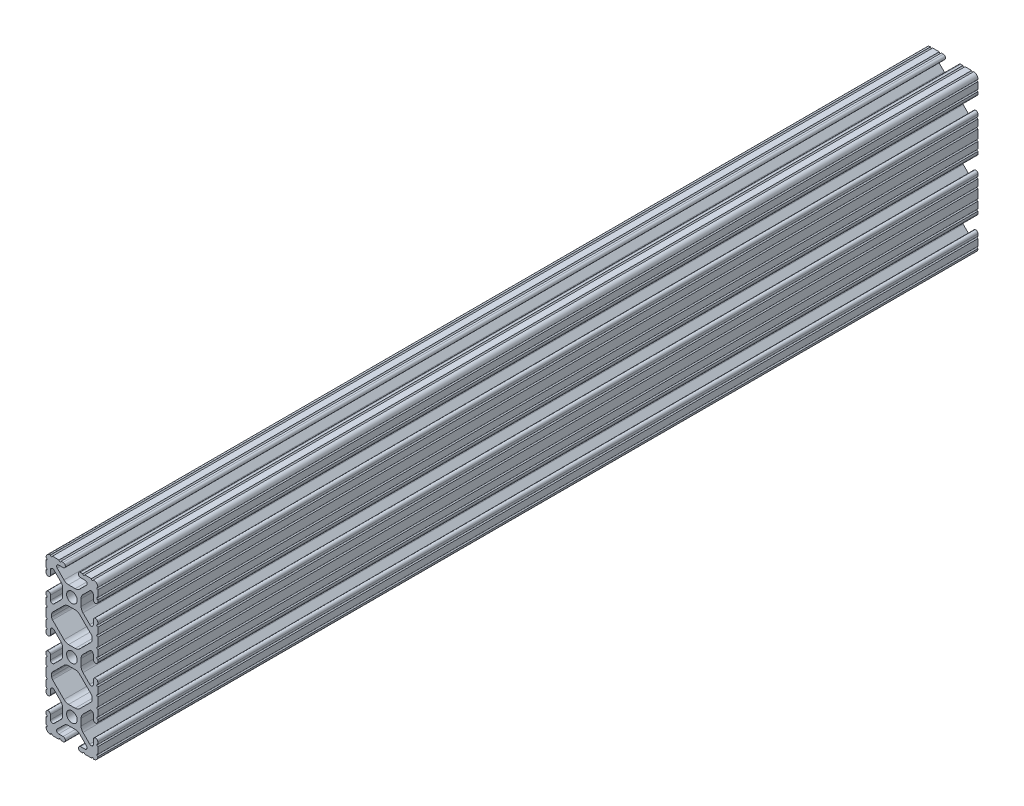
from build123d import *

# Parameters (mm, degrees)
SKETCH1_R           = 2.6035
BOSS_EXTRUDE1_DEPTH = 431.8


with BuildPart() as part:
    # Sketch1 → Boss-Extrude1 (new body)
    with BuildSketch(Plane.XY):
        with BuildLine():
            Line((-6.3246, 38.1), (-9.5504, 38.1))
            ThreePointArc((-9.5504, 38.1), (-10.0584, 37.592), (-10.5664, 38.1))
            ThreePointArc((-10.5664, 38.1), (-12.082677406, 37.482677406), (-12.7, 35.9664))
            ThreePointArc((-12.7, 35.9664), (-12.192, 35.4584), (-12.7, 34.9504))
            Line((-12.7, 34.9504), (-12.7, 31.7246))
            ThreePointArc((-12.7, 31.7246), (-12.192, 31.2166), (-12.7, 30.7086))
            Line((-12.7, 30.7086), (-12.7, 29.702307889))
            ThreePointArc((-12.7, 29.702307889), (-11.5951, 28.597407889), (-10.4902, 29.702307889))
            Line((-10.4902, 29.702307889), (-10.4902, 31.874794456))
            ThreePointArc((-10.4902, 31.874794456), (-9.863006367, 32.813456061), (-8.75577951, 32.593214945))
            Line((-8.75577951, 32.593214945), (-5.43843597, 29.275871405))
            ThreePointArc((-5.43843597, 29.275871405), (-4.750182484, 28.245827272), (-4.5085, 27.030807374))
            Line((-4.5085, 27.030807374), (-4.5085, 23.769192626))
            ThreePointArc((-4.5085, 23.769192626), (-4.750182484, 22.554172728), (-5.43843597, 21.524128595))
            Line((-5.43843597, 21.524128595), (-8.75577951, 18.206785055))
            ThreePointArc((-8.75577951, 18.206785055), (-9.863006367, 17.986543939), (-10.4902, 18.925205544))
            Line((-10.4902, 18.925205544), (-10.4902, 21.097692111))
            ThreePointArc((-10.4902, 21.097692111), (-11.5951, 22.202592111), (-12.7, 21.097692111))
            Line((-12.7, 21.097692111), (-12.7, 20.0914))
            ThreePointArc((-12.7, 20.0914), (-12.192, 19.5834), (-12.7, 19.0754))
            Line((-12.7, 19.0754), (-12.7, 15.8496))
            ThreePointArc((-12.7, 15.8496), (-12.192, 15.3416), (-12.7, 14.8336))
            Line((-12.7, 14.8336), (-12.7, 10.5664))
            ThreePointArc((-12.7, 10.5664), (-12.192, 10.0584), (-12.7, 9.5504))
            Line((-12.7, 9.5504), (-12.7, 6.3246))
            ThreePointArc((-12.7, 6.3246), (-12.192, 5.8166), (-12.7, 5.3086))
            Line((-12.7, 5.3086), (-12.7, 4.302307889))
            ThreePointArc((-12.7, 4.302307889), (-11.5951, 3.197407889), (-10.4902, 4.302307889))
            Line((-10.4902, 4.302307889), (-10.4902, 6.474794456))
            ThreePointArc((-10.4902, 6.474794456), (-9.863006367, 7.413456061), (-8.75577951, 7.193214945))
            Line((-8.75577951, 7.193214945), (-5.43843597, 3.875871405))
            ThreePointArc((-5.43843597, 3.875871405), (-4.750182484, 2.845827272), (-4.5085, 1.630807374))
            Line((-4.5085, 1.630807374), (-4.5085, -1.630807374))
            ThreePointArc((-4.5085, -1.630807374), (-4.750182484, -2.845827272), (-5.43843597, -3.875871405))
            Line((-5.43843597, -3.875871405), (-8.75577951, -7.193214945))
            ThreePointArc((-8.75577951, -7.193214945), (-9.863006367, -7.413456061), (-10.4902, -6.474794456))
            Line((-10.4902, -6.474794456), (-10.4902, -4.302307889))
            ThreePointArc((-10.4902, -4.302307889), (-11.5951, -3.197407889), (-12.7, -4.302307889))
            Line((-12.7, -4.302307889), (-12.7, -5.3086))
            ThreePointArc((-12.7, -5.3086), (-12.192, -5.8166), (-12.7, -6.3246))
            Line((-12.7, -6.3246), (-12.7, -9.5504))
            ThreePointArc((-12.7, -9.5504), (-12.192, -10.0584), (-12.7, -10.5664))
            Line((-12.7, -10.5664), (-12.7, -14.8336))
            ThreePointArc((-12.7, -14.8336), (-12.192, -15.3416), (-12.7, -15.8496))
            Line((-12.7, -15.8496), (-12.7, -19.0754))
            ThreePointArc((-12.7, -19.0754), (-12.192, -19.5834), (-12.7, -20.0914))
            Line((-12.7, -20.0914), (-12.7, -21.097692111))
            ThreePointArc((-12.7, -21.097692111), (-11.5951, -22.202592111), (-10.4902, -21.097692111))
            Line((-10.4902, -21.097692111), (-10.4902, -18.925205544))
            ThreePointArc((-10.4902, -18.925205544), (-9.863006367, -17.986543939), (-8.75577951, -18.206785055))
            Line((-8.75577951, -18.206785055), (-5.43843597, -21.524128595))
            ThreePointArc((-5.43843597, -21.524128595), (-4.750182484, -22.554172728), (-4.5085, -23.769192626))
            Line((-4.5085, -23.769192626), (-4.5085, -27.030807374))
            ThreePointArc((-4.5085, -27.030807374), (-4.750182484, -28.245827272), (-5.43843597, -29.275871405))
            Line((-5.43843597, -29.275871405), (-8.75577951, -32.593214945))
            ThreePointArc((-8.75577951, -32.593214945), (-9.863006367, -32.813456061), (-10.4902, -31.874794456))
            Line((-10.4902, -31.874794456), (-10.4902, -29.702307889))
            ThreePointArc((-10.4902, -29.702307889), (-11.5951, -28.597407889), (-12.7, -29.702307889))
            Line((-12.7, -29.702307889), (-12.7, -30.7086))
            ThreePointArc((-12.7, -30.7086), (-12.192, -31.2166), (-12.7, -31.7246))
            Line((-12.7, -31.7246), (-12.7, -34.9504))
            ThreePointArc((-12.7, -34.9504), (-12.192, -35.4584), (-12.7, -35.9664))
            ThreePointArc((-12.7, -35.9664), (-12.082677406, -37.482677406), (-10.5664, -38.1))
            ThreePointArc((-10.5664, -38.1), (-10.0584, -37.592), (-9.5504, -38.1))
            Line((-9.5504, -38.1), (-6.3246, -38.1))
            ThreePointArc((-6.3246, -38.1), (-5.8166, -37.592), (-5.3086, -38.1))
            Line((-5.3086, -38.1), (-4.302307889, -38.1))
            ThreePointArc((-4.302307889, -38.1), (-3.197407889, -36.9951), (-4.302307889, -35.8902))
            Line((-4.302307889, -35.8902), (-6.474794456, -35.8902))
            ThreePointArc((-6.474794456, -35.8902), (-7.413456061, -35.263006367), (-7.193214945, -34.15577951))
            Line((-7.193214945, -34.15577951), (-3.875871405, -30.83843597))
            ThreePointArc((-3.875871405, -30.83843597), (-2.845827272, -30.150182484), (-1.630807374, -29.9085))
            Line((-1.630807374, -29.9085), (1.630807374, -29.9085))
            ThreePointArc((1.630807374, -29.9085), (2.845827272, -30.150182484), (3.875871405, -30.83843597))
            Line((3.875871405, -30.83843597), (7.193214945, -34.15577951))
            ThreePointArc((7.193214945, -34.15577951), (7.413456061, -35.263006367), (6.474794456, -35.8902))
            Line((6.474794456, -35.8902), (4.302307889, -35.8902))
            ThreePointArc((4.302307889, -35.8902), (3.197407889, -36.9951), (4.302307889, -38.1))
            Line((4.302307889, -38.1), (5.3086, -38.1))
            ThreePointArc((5.3086, -38.1), (5.8166, -37.592), (6.3246, -38.1))
            Line((6.3246, -38.1), (9.5504, -38.1))
            ThreePointArc((9.5504, -38.1), (10.0584, -37.592), (10.5664, -38.1))
            ThreePointArc((10.5664, -38.1), (12.082677406, -37.482677406), (12.7, -35.9664))
            ThreePointArc((12.7, -35.9664), (12.192, -35.4584), (12.7, -34.9504))
            Line((12.7, -34.9504), (12.7, -31.7246))
            ThreePointArc((12.7, -31.7246), (12.192, -31.2166), (12.7, -30.7086))
            Line((12.7, -30.7086), (12.7, -29.702307918))
            ThreePointArc((12.7, -29.702307918), (11.5951, -28.597407918), (10.4902, -29.702307918))
            Line((10.4902, -29.702307918), (10.4902, -31.874794456))
            ThreePointArc((10.4902, -31.874794456), (9.863006367, -32.813456061), (8.75577951, -32.593214945))
            Line((8.75577951, -32.593214945), (5.43843597, -29.275871405))
            ThreePointArc((5.43843597, -29.275871405), (4.750182484, -28.245827272), (4.5085, -27.030807374))
            Line((4.5085, -27.030807374), (4.5085, -23.769192626))
            ThreePointArc((4.5085, -23.769192626), (4.750182484, -22.554172728), (5.43843597, -21.524128595))
            Line((5.43843597, -21.524128595), (8.75577951, -18.206785055))
            ThreePointArc((8.75577951, -18.206785055), (9.863006367, -17.986543939), (10.4902, -18.925205544))
            Line((10.4902, -18.925205544), (10.4902, -21.097692058))
            ThreePointArc((10.4902, -21.097692058), (11.5951, -22.202592058), (12.7, -21.097692058))
            Line((12.7, -21.097692058), (12.7, -20.0914))
            ThreePointArc((12.7, -20.0914), (12.192, -19.5834), (12.7, -19.0754))
            Line((12.7, -19.0754), (12.7, -15.8496))
            ThreePointArc((12.7, -15.8496), (12.192, -15.3416), (12.7, -14.8336))
            Line((12.7, -14.8336), (12.7, -10.5664))
            ThreePointArc((12.7, -10.5664), (12.192, -10.0584), (12.7, -9.5504))
            Line((12.7, -9.5504), (12.7, -6.3246))
            ThreePointArc((12.7, -6.3246), (12.192, -5.8166), (12.7, -5.3086))
            Line((12.7, -5.3086), (12.7, -4.302307889))
            ThreePointArc((12.7, -4.302307889), (11.5951, -3.197407889), (10.4902, -4.302307889))
            Line((10.4902, -4.302307889), (10.4902, -6.474794456))
            ThreePointArc((10.4902, -6.474794456), (9.863006367, -7.413456061), (8.75577951, -7.193214945))
            Line((8.75577951, -7.193214945), (5.43843597, -3.875871405))
            ThreePointArc((5.43843597, -3.875871405), (4.750182484, -2.845827272), (4.5085, -1.630807374))
            Line((4.5085, -1.630807374), (4.5085, 1.630807374))
            ThreePointArc((4.5085, 1.630807374), (4.750182484, 2.845827272), (5.43843597, 3.875871405))
            Line((5.43843597, 3.875871405), (8.75577951, 7.193214945))
            ThreePointArc((8.75577951, 7.193214945), (9.863006367, 7.413456061), (10.4902, 6.474794456))
            Line((10.4902, 6.474794456), (10.4902, 4.302307889))
            ThreePointArc((10.4902, 4.302307889), (11.5951, 3.197407889), (12.7, 4.302307889))
            Line((12.7, 4.302307889), (12.7, 5.3086))
            ThreePointArc((12.7, 5.3086), (12.192, 5.8166), (12.7, 6.3246))
            Line((12.7, 6.3246), (12.7, 9.5504))
            ThreePointArc((12.7, 9.5504), (12.192, 10.0584), (12.7, 10.5664))
            Line((12.7, 10.5664), (12.7, 14.8336))
            ThreePointArc((12.7, 14.8336), (12.192, 15.3416), (12.7, 15.8496))
            Line((12.7, 15.8496), (12.7, 19.0754))
            ThreePointArc((12.7, 19.0754), (12.192, 19.5834), (12.7, 20.0914))
            Line((12.7, 20.0914), (12.7, 21.097692082))
            ThreePointArc((12.7, 21.097692082), (11.5951, 22.202592082), (10.4902, 21.097692082))
            Line((10.4902, 21.097692082), (10.4902, 18.925205544))
            ThreePointArc((10.4902, 18.925205544), (9.863006367, 17.986543939), (8.75577951, 18.206785055))
            Line((8.75577951, 18.206785055), (5.43843597, 21.524128595))
            ThreePointArc((5.43843597, 21.524128595), (4.750182484, 22.554172728), (4.5085, 23.769192626))
            Line((4.5085, 23.769192626), (4.5085, 27.030807374))
            ThreePointArc((4.5085, 27.030807374), (4.750182484, 28.245827272), (5.43843597, 29.275871405))
            Line((5.43843597, 29.275871405), (8.75577951, 32.593214945))
            ThreePointArc((8.75577951, 32.593214945), (9.863006367, 32.813456061), (10.4902, 31.874794456))
            Line((10.4902, 31.874794456), (10.4902, 29.702307889))
            ThreePointArc((10.4902, 29.702307889), (11.5951, 28.597407889), (12.7, 29.702307889))
            Line((12.7, 29.702307889), (12.7, 30.7086))
            ThreePointArc((12.7, 30.7086), (12.192, 31.2166), (12.7, 31.7246))
            Line((12.7, 31.7246), (12.7, 34.9504))
            ThreePointArc((12.7, 34.9504), (12.192, 35.4584), (12.7, 35.9664))
            ThreePointArc((12.7, 35.9664), (12.082677406, 37.482677406), (10.5664, 38.1))
            ThreePointArc((10.5664, 38.1), (10.0584, 37.592), (9.5504, 38.1))
            Line((9.5504, 38.1), (6.3246, 38.1))
            ThreePointArc((6.3246, 38.1), (5.8166, 37.592), (5.3086, 38.1))
            Line((5.3086, 38.1), (4.302307889, 38.1))
            ThreePointArc((4.302307889, 38.1), (3.197407889, 36.9951), (4.302307889, 35.8902))
            Line((4.302307889, 35.8902), (6.474794456, 35.8902))
            ThreePointArc((6.474794456, 35.8902), (7.413456061, 35.263006367), (7.193214945, 34.15577951))
            Line((7.193214945, 34.15577951), (3.875871405, 30.83843597))
            ThreePointArc((3.875871405, 30.83843597), (2.845827272, 30.150182484), (1.630807374, 29.9085))
            Line((1.630807374, 29.9085), (-1.630807374, 29.9085))
            ThreePointArc((-1.630807374, 29.9085), (-2.845827272, 30.150182484), (-3.875871405, 30.83843597))
            Line((-3.875871405, 30.83843597), (-7.193214945, 34.15577951))
            ThreePointArc((-7.193214945, 34.15577951), (-7.413456061, 35.263006367), (-6.474794456, 35.8902))
            Line((-6.474794456, 35.8902), (-4.302307889, 35.8902))
            ThreePointArc((-4.302307889, 35.8902), (-3.197407889, 36.9951), (-4.302307889, 38.1))
            Line((-4.302307889, 38.1), (-5.3086, 38.1))
            ThreePointArc((-5.3086, 38.1), (-5.8166, 37.592), (-6.3246, 38.1))
        make_face()
        with Locations((0, 25.4)):
            Circle(SKETCH1_R, mode=Mode.SUBTRACT)
        with Locations((0, -25.4)):
            Circle(SKETCH1_R, mode=Mode.SUBTRACT)
        Circle(SKETCH1_R, mode=Mode.SUBTRACT)
        with BuildLine():
            Line((-9.9314, 12.146268083), (-9.9314, 13.253731917))
            ThreePointArc((-9.9314, 13.253731917), (-9.811525488, 13.856381786), (-9.470151759, 14.367283676))
            Line((-9.470151759, 14.367283676), (-3.875871405, 19.96156403))
            ThreePointArc((-3.875871405, 19.96156403), (-2.845827272, 20.649817516), (-1.630807374, 20.8915))
            Line((-1.630807374, 20.8915), (1.630807374, 20.8915))
            ThreePointArc((1.630807374, 20.8915), (2.845827272, 20.649817516), (3.875871405, 19.96156403))
            Line((3.875871405, 19.96156403), (9.470151759, 14.367283676))
            ThreePointArc((9.470151759, 14.367283676), (9.811525488, 13.856381786), (9.9314, 13.253731917))
            Line((9.9314, 13.253731917), (9.9314, 12.146268083))
            ThreePointArc((9.9314, 12.146268083), (9.811525488, 11.543618214), (9.470151759, 11.032716324))
            Line((9.470151759, 11.032716324), (3.875871405, 5.43843597))
            ThreePointArc((3.875871405, 5.43843597), (2.845827272, 4.750182484), (1.630807374, 4.5085))
            Line((1.630807374, 4.5085), (-1.630807374, 4.5085))
            ThreePointArc((-1.630807374, 4.5085), (-2.845827272, 4.750182484), (-3.875871405, 5.43843597))
            Line((-3.875871405, 5.43843597), (-9.470151759, 11.032716324))
            ThreePointArc((-9.470151759, 11.032716324), (-9.811525488, 11.543618214), (-9.9314, 12.146268083))
        make_face(mode=Mode.SUBTRACT)
        with BuildLine():
            Line((-9.9314, -13.253731917), (-9.9314, -12.146268083))
            ThreePointArc((-9.9314, -12.146268083), (-9.811525488, -11.543618214), (-9.470151759, -11.032716324))
            Line((-9.470151759, -11.032716324), (-3.875871405, -5.43843597))
            ThreePointArc((-3.875871405, -5.43843597), (-2.845827272, -4.750182484), (-1.630807374, -4.5085))
            Line((-1.630807374, -4.5085), (1.630807374, -4.5085))
            ThreePointArc((1.630807374, -4.5085), (2.845827272, -4.750182484), (3.875871405, -5.43843597))
            Line((3.875871405, -5.43843597), (9.470151759, -11.032716324))
            ThreePointArc((9.470151759, -11.032716324), (9.811525488, -11.543618214), (9.9314, -12.146268083))
            Line((9.9314, -12.146268083), (9.9314, -13.253731917))
            ThreePointArc((9.9314, -13.253731917), (9.811525488, -13.856381786), (9.470151759, -14.367283676))
            Line((9.470151759, -14.367283676), (3.875871405, -19.96156403))
            ThreePointArc((3.875871405, -19.96156403), (2.845827272, -20.649817516), (1.630807374, -20.8915))
            Line((1.630807374, -20.8915), (-1.630807374, -20.8915))
            ThreePointArc((-1.630807374, -20.8915), (-2.845827272, -20.649817516), (-3.875871405, -19.96156403))
            Line((-3.875871405, -19.96156403), (-9.470151759, -14.367283676))
            ThreePointArc((-9.470151759, -14.367283676), (-9.811525488, -13.856381786), (-9.9314, -13.253731917))
        make_face(mode=Mode.SUBTRACT)
    extrude(amount=-BOSS_EXTRUDE1_DEPTH)


solid = part.part
